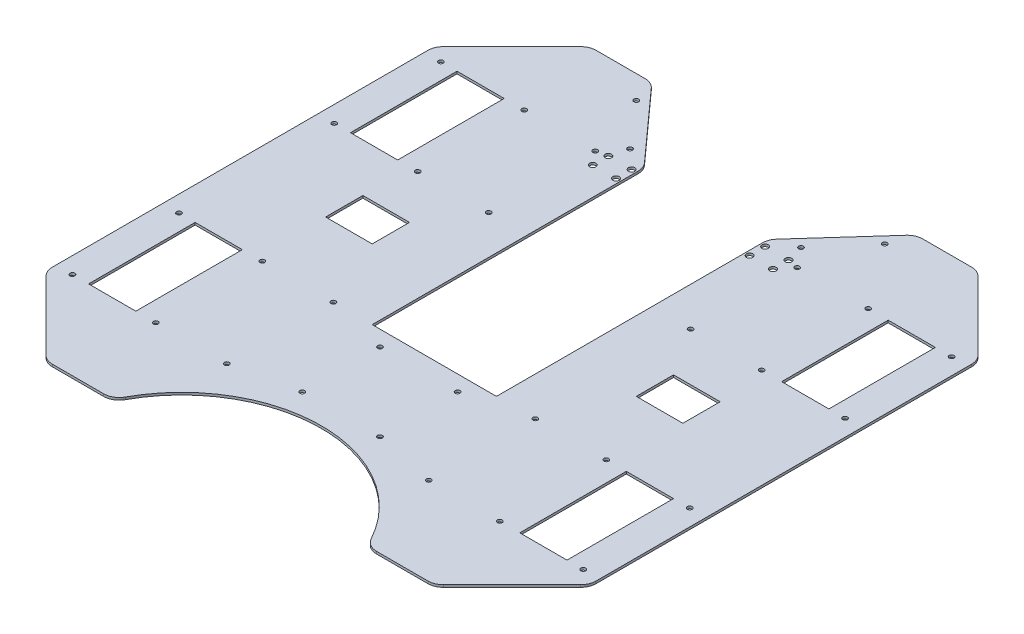
from build123d import *

# Parameters (mm, degrees)
SKETCH_1_R          = 1.55
SKETCH_1_R_2        = 2.05
SKETCH_1_W          = 30.4
SKETCH_1_H          = 68.58
EXTRUDE_1_DEPTH     = 1.5
FILLET_1_R          = 10
FILLET_2_R          = 10
FILLET_3_R          = 10
SKETCH_2_W          = 80
SKETCH_2_H          = 135
CUT_EXTRUDE_1_DEPTH = 10
SKETCH_3_W          = 30
SKETCH_3_H          = 24
CUT_EXTRUDE_2_DEPTH = 10


with BuildPart() as part:
    # 草图1 → 凸台-拉伸1 (new body)
    with BuildSketch(Plane(origin=(0, 0, 0), x_dir=(1, 0, 0), z_dir=(0, 1, 0))):
        with BuildLine():
            Line((-125, 175), (-175, 125))
            Line((-175, 125), (-175, -125))
            Line((-175, -125), (-125, -175))
            Line((-125, -175), (-81.710313025, -175))
            ThreePointArc((-81.710313025, -175), (0, -122.728301649), (81.710313025, -175))
            Line((81.710313025, -175), (125, -175))
            Line((125, -175), (175, -125))
            Line((175, -125), (175, 125))
            Line((175, 125), (125, 175))
            Line((125, 175), (85, 175))
            Line((85, 175), (40, 125))
            Line((40, 125), (40, 85))
            Line((40, 85), (-40, 85))
            Line((-40, 85), (-40, 125))
            Line((-40, 125), (-85, 175))
            Line((-85, 175), (-125, 175))
        make_face()
        with Locations((-55, 131)):
            Circle(SKETCH_1_R, mode=Mode.SUBTRACT)
        with Locations((-80, 160)):
            Circle(SKETCH_1_R, mode=Mode.SUBTRACT)
        with Locations((55, 131)):
            Circle(SKETCH_1_R, mode=Mode.SUBTRACT)
        with Locations((80, 160)):
            Circle(SKETCH_1_R, mode=Mode.SUBTRACT)
        with Locations((-65, 118.58)):
            Circle(SKETCH_1_R, mode=Mode.SUBTRACT)
        with Locations((-65, 50)):
            Circle(SKETCH_1_R, mode=Mode.SUBTRACT)
        with Locations((-110.72, 50)):
            Circle(SKETCH_1_R, mode=Mode.SUBTRACT)
        with Locations((-110.72, 118.58)):
            Circle(SKETCH_1_R, mode=Mode.SUBTRACT)
        with Locations((-164.434, 118.58)):
            Circle(SKETCH_1_R, mode=Mode.SUBTRACT)
        with Locations((-164.434, 50)):
            Circle(SKETCH_1_R, mode=Mode.SUBTRACT)
        with Locations((-65, -118.58)):
            Circle(SKETCH_1_R, mode=Mode.SUBTRACT)
        with Locations((-65, -50)):
            Circle(SKETCH_1_R, mode=Mode.SUBTRACT)
        with Locations((-110.72, -50)):
            Circle(SKETCH_1_R, mode=Mode.SUBTRACT)
        with Locations((-110.72, -118.58)):
            Circle(SKETCH_1_R, mode=Mode.SUBTRACT)
        with Locations((-164.434, -50)):
            Circle(SKETCH_1_R, mode=Mode.SUBTRACT)
        with Locations((-164.434, -118.58)):
            Circle(SKETCH_1_R, mode=Mode.SUBTRACT)
        with Locations((65, 50)):
            Circle(SKETCH_1_R, mode=Mode.SUBTRACT)
        with Locations((110.72, 50)):
            Circle(SKETCH_1_R, mode=Mode.SUBTRACT)
        with Locations((110.72, 118.58)):
            Circle(SKETCH_1_R, mode=Mode.SUBTRACT)
        with Locations((65, 118.58)):
            Circle(SKETCH_1_R, mode=Mode.SUBTRACT)
        with Locations((164.434, 118.58)):
            Circle(SKETCH_1_R, mode=Mode.SUBTRACT)
        with Locations((164.434, 50)):
            Circle(SKETCH_1_R, mode=Mode.SUBTRACT)
        with Locations((164.434, -118.58)):
            Circle(SKETCH_1_R, mode=Mode.SUBTRACT)
        with Locations((164.434, -50)):
            Circle(SKETCH_1_R, mode=Mode.SUBTRACT)
        with Locations((110.72, -50)):
            Circle(SKETCH_1_R, mode=Mode.SUBTRACT)
        with Locations((110.72, -118.58)):
            Circle(SKETCH_1_R, mode=Mode.SUBTRACT)
        with Locations((65, -118.58)):
            Circle(SKETCH_1_R, mode=Mode.SUBTRACT)
        with Locations((65, -50)):
            Circle(SKETCH_1_R, mode=Mode.SUBTRACT)
        with Locations((25, -60)):
            Circle(SKETCH_1_R, mode=Mode.SUBTRACT)
        with Locations((25, -110)):
            Circle(SKETCH_1_R, mode=Mode.SUBTRACT)
        with Locations((-25, -60)):
            Circle(SKETCH_1_R, mode=Mode.SUBTRACT)
        with Locations((-25, -110)):
            Circle(SKETCH_1_R, mode=Mode.SUBTRACT)
        with Locations((-43, 120)):
            Circle(SKETCH_1_R_2, mode=Mode.SUBTRACT)
        with Locations((-43, 110)):
            Circle(SKETCH_1_R_2, mode=Mode.SUBTRACT)
        with Locations((-58, 110)):
            Circle(SKETCH_1_R_2, mode=Mode.SUBTRACT)
        with Locations((-58, 120)):
            Circle(SKETCH_1_R_2, mode=Mode.SUBTRACT)
        with Locations((43, 120)):
            Circle(SKETCH_1_R_2, mode=Mode.SUBTRACT)
        with Locations((58, 120)):
            Circle(SKETCH_1_R_2, mode=Mode.SUBTRACT)
        with Locations((58, 110)):
            Circle(SKETCH_1_R_2, mode=Mode.SUBTRACT)
        with Locations((43, 110)):
            Circle(SKETCH_1_R_2, mode=Mode.SUBTRACT)
        with Locations((-138.794, 84.29)):
            Rectangle(SKETCH_1_W, SKETCH_1_H, mode=Mode.SUBTRACT)
        with Locations((138.794, 84.29)):
            Rectangle(SKETCH_1_W, SKETCH_1_H, mode=Mode.SUBTRACT)
        with Locations((-138.794, -84.29)):
            Rectangle(SKETCH_1_W, SKETCH_1_H, mode=Mode.SUBTRACT)
        with Locations((138.794, -84.29)):
            Rectangle(SKETCH_1_W, SKETCH_1_H, mode=Mode.SUBTRACT)
    extrude(amount=EXTRUDE_1_DEPTH)

    # 圆角1
    fillet_1_edges = [part.edges().sort_by_distance(p)[0] for p in [
        (-40, 0.75, -125),
    ]]
    fillet(fillet_1_edges, radius=FILLET_1_R)

    # 圆角2
    fillet_2_edges = [part.edges().sort_by_distance(p)[0] for p in [
        (40, 0.75, -125),
    ]]
    fillet(fillet_2_edges, radius=FILLET_2_R)

    # 圆角3
    fillet_3_edges = [part.edges().sort_by_distance(p)[0] for p in [
        (-85, 0.75, -175),
        (85, 0.75, -175),
        (125, 0.75, -175),
        (175, 0.75, -125),
        (175, 0.75, 125),
        (125, 0.75, 175),
        (81.710313025, 0.75, 175),
        (-81.710313025, 0.75, 175),
        (-125, 0.75, 175),
        (-175, 0.75, 125),
        (-175, 0.75, -125),
        (-125, 0.75, -175),
    ]]
    fillet(fillet_3_edges, radius=FILLET_3_R)

    # 草图2 → 切除-拉伸1 (cut)
    with BuildSketch(Plane(origin=(0, 1.5, 0), x_dir=(1, 0, 0), z_dir=(0, 1, 0))):
        with Locations((0, 17.5)):
            Rectangle(SKETCH_2_W, SKETCH_2_H)
    extrude(amount=-CUT_EXTRUDE_1_DEPTH, mode=Mode.SUBTRACT)

    # 草图3 → 切除-拉伸2 (cut)
    with BuildSketch(Plane(origin=(0, 1.5, 0), x_dir=(1, 0, 0), z_dir=(0, 1, 0))):
        with Locations((-100, 7)):
            Rectangle(SKETCH_3_W, SKETCH_3_H)
        with Locations((100, 7)):
            Rectangle(SKETCH_3_W, SKETCH_3_H)
    extrude(amount=-CUT_EXTRUDE_2_DEPTH, mode=Mode.SUBTRACT)


solid = part.part
